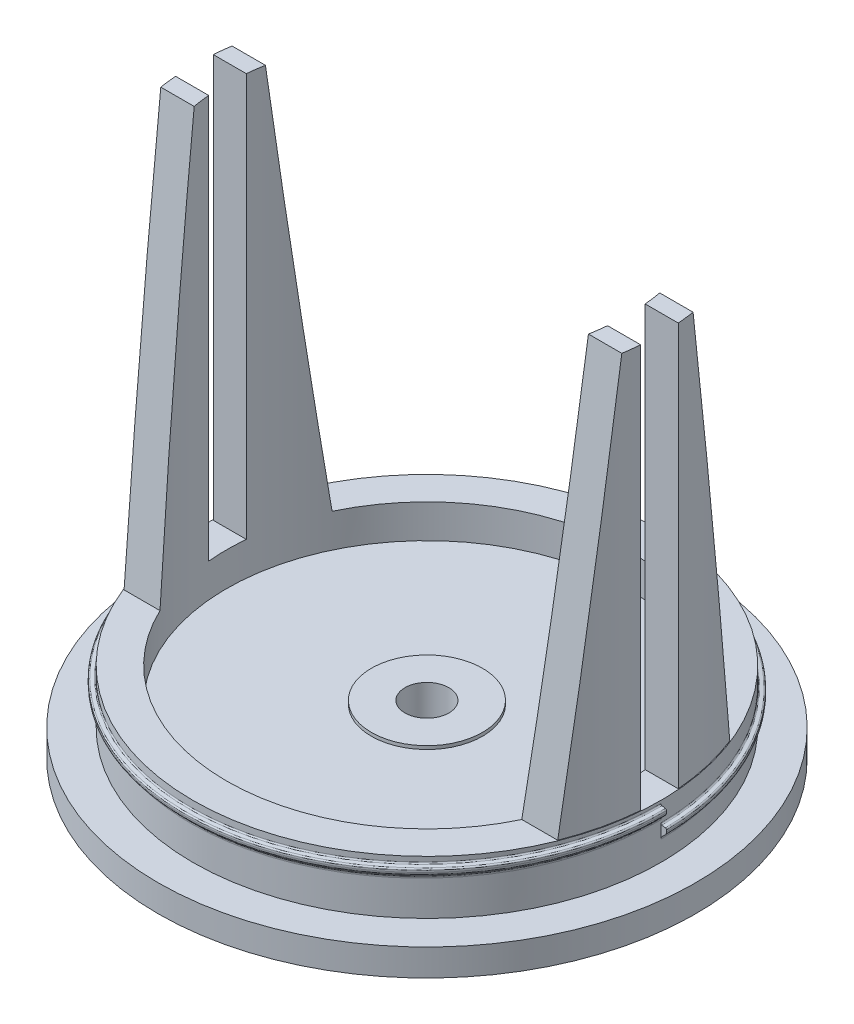
from build123d import *
from build123d.topology import SkipClean

# Parameters (mm, degrees)
SKETCH1_R           = 50.8
BOSS_EXTRUDE1_DEPTH = 5.08
SKETCH2_R           = 44.196
BOSS_EXTRUDE2_DEPTH = 10.16
THREAD1_PITCH       = 3.175
CUT_EXTRUDE1_REACH  = 75.441
SKETCH7_R           = 4.15
SKETCH8_R           = 37.846
SKETCH8_R_2         = 10.5
CUT_EXTRUDE4_DEPTH  = 6.35
SKETCH10_R          = 10.5
CUT_EXTRUDE5_DEPTH  = 5.715
BOSS_EXTRUDE3_DEPTH = 76.2
CUT_EXTRUDE6_REACH  = 118.287
CIRPATTERN2_COUNT   = 2
CUT_EXTRUDE7_DEPTH  = 2.54
FILLET1_R           = 0.762
CIRPATTERN3_COUNT   = 8
SKETCH13_R          = 20.6375
BOSS_EXTRUDE4_DEPTH = 9.525
SKETCH14_R          = 44.196
SKETCH14_R_2        = 44.069
CUT_EXTRUDE9_DEPTH  = 76.2


with BuildPart() as part:
    # Sketch1 → Boss-Extrude1 (new body)
    with BuildSketch(Plane(origin=(0, 0, 0), x_dir=(1, 0, 0), z_dir=(0, 1, 0))):
        with Locations(Location((0, 0, 0), (0, 0, 270))):
            Circle(SKETCH1_R)
    extrude(amount=BOSS_EXTRUDE1_DEPTH)

    # Sketch2 → Boss-Extrude2 (add)
    with BuildSketch(Plane(origin=(0, 5.08, 0), x_dir=(1, 0, 0), z_dir=(0, 1, 0))):
        with Locations(Location((0, 0, 0), (0, 0, 270))):
            Circle(SKETCH2_R)
    extrude(amount=BOSS_EXTRUDE2_DEPTH)

    # Thread1: the profile of Thread Profile1 profile screwed along a right-hand helix of 1 turns, 12 arcs to a turn; built about Z, then put on its axis
    thread1_z = Axis((0, 0, 0), (0, 0, 1))
    thread1_corners = [(44.1957, 0, 0), (44.1957, 0, 2.662362041), (44.196, 0, 2.662362041), (44.405893363, 0, 2.412220872), (45.052906637, 0, 2.298134974), (45.2628, 0, 2.047993805), (45.2628, 0, 1.698061469), (45.039615367, 0, 1.159246102), (44.419184633, 0, 0.538815367), (44.196, 0, 0)]
    with BuildLine(mode=Mode.PRIVATE) as thread1_profile:
        Line(thread1_corners[0], thread1_corners[1])
        Line(thread1_corners[3], thread1_corners[4])
        Line(thread1_corners[5], thread1_corners[6])
        Line(thread1_corners[7], thread1_corners[8])
        Line(thread1_corners[9], thread1_corners[0])
        Line(thread1_corners[2], thread1_corners[1])
        ThreePointArc((44.196, 0, 2.662362041), (44.255424711, 0, 2.499093988), (44.405893363, 0, 2.412220872))
        ThreePointArc((45.052906637, 0, 2.298134974), (45.203375289, 0, 2.211261858), (45.2628, 0, 2.047993805))
        ThreePointArc((45.2628, 0, 1.698061469), (45.204796204, 0, 1.406456694), (45.039615367, 0, 1.159246102))
        ThreePointArc((44.419184633, 0, 0.538815367), (44.254003796, 0, 0.291604775), (44.196, 0, 0))
    thread1_cap = Face(thread1_profile.wire())
    thread1_arcs = [((44.196, 0, 2.662362041), (44.196, 0, 2.449230735), (44.405893363, 0, 2.412220872), (1, 0.7660444431189758, 1)), ((45.052906637, 0, 2.298134974), (45.2628, 0, 2.261125112), (45.2628, 0, 2.047993805), (1, 0.7660444431189757, 1)), ((45.2628, 0, 1.698061469), (45.2628, 0, 1.382430735), (45.039615367, 0, 1.159246102), (1, 0.923879532511285, 1)), ((44.419184633, 0, 0.538815367), (44.196, 0, 0.315630735), (44.196, 0, 0), (1, 0.9238795325112861, 1))]  # start, shoulder, end, weights
    thread1_turn_angles = [0, 15, 30, 45, 60, 75, 90, 105, 120, 135, 150, 165, 180, 195, 210, 225, 240, 255, 270, 285, 300, 315, 330, 345, 360]
    thread1_turn_weights = [1, 0.9659258262890683, 1, 0.9659258262890683, 1, 0.9659258262890683, 1, 0.9659258262890683, 1, 0.9659258262890683, 1, 0.9659258262890683, 1, 0.9659258262890683, 1, 0.9659258262890683, 1, 0.9659258262890683, 1, 0.9659258262890683, 1, 0.9659258262890683, 1, 0.9659258262890683, 1]
    thread1_turn_rails = [Edge.make_bspline([Vector(p[0], p[1], 0).rotate(thread1_z, thread1_turn_angles[k]) / thread1_turn_weights[k] + Vector(0, 0, p[2] + THREAD1_PITCH * thread1_turn_angles[k] / 360) for k in range(25)], [0, 0, 0, 1, 1, 2, 2, 3, 3, 4, 4, 5, 5, 6, 6, 7, 7, 8, 8, 9, 9, 10, 10, 11, 11, 12, 12, 12], 2, thread1_turn_weights) for p in thread1_corners]
    thread1_turn_sides = [*[Face.make_surface_from_curves(thread1_turn_rails[p[0]], thread1_turn_rails[p[1]]) for p in [(0, 1), (3, 4), (5, 6), (7, 8), (9, 0), (2, 1)]], *[Face.make_bezier_surface([[Vector(p[j][0], p[j][1], 0).rotate(thread1_z, thread1_turn_angles[2 * i + k]) / thread1_turn_weights[2 * i + k] + Vector(0, 0, p[j][2] + THREAD1_PITCH * thread1_turn_angles[2 * i + k] / 360) for k in range(3)] for j in range(3)], [[p[3][j] * thread1_turn_weights[2 * i + k] for k in range(3)] for j in range(3)]) for p in thread1_arcs for i in range(12)]]
    thread1 = Plane(origin=(0, 8.89, 0), x_dir=(1, 0, 0), z_dir=(0, 1, 0)) * Solid(Shell([*thread1_turn_sides, thread1_cap, thread1_cap.rotate(thread1_z, 360).moved(Location((0, 0, THREAD1_PITCH * 360 / 360)))]))
    add(thread1)

    # Sketch7 → Cut-Extrude1 (cut, up to next)
    with BuildSketch(Plane.XZ, mode=Mode.PRIVATE) as cut_extrude1_sk1:
        with Locations(Location((0, 0, 0), (0, 0, 270))):
            Circle(SKETCH7_R)
    cut_extrude1_tool1 = extrude(cut_extrude1_sk1.sketch, amount=-CUT_EXTRUDE1_REACH, mode=Mode.PRIVATE) & part.part
    add(cut_extrude1_tool1.solids().sort_by_distance((0, 0, 0))[0], mode=Mode.SUBTRACT)

    # Sketch8 → Cut-Extrude4 (cut)
    with BuildSketch(Plane(origin=(0, 15.24, 0), x_dir=(1, 0, 0), z_dir=(0, 1, 0))):
        with Locations(Location((0, 0, 0), (0, 0, 270))):
            Circle(SKETCH8_R)
        with Locations(Location((0, 0, 0), (0, 0, 270))):
            Circle(SKETCH8_R_2, mode=Mode.SUBTRACT)
    extrude(amount=-CUT_EXTRUDE4_DEPTH, mode=Mode.SUBTRACT)

    # Sketch10 → Cut-Extrude5 (cut)
    with BuildSketch(Plane(origin=(0, 15.24, 0), x_dir=(1, 0, 0), z_dir=(0, 1, 0))):
        with Locations(Location((0, 0, 0), (0, 0, 270))):
            Circle(SKETCH10_R)
    extrude(amount=-CUT_EXTRUDE5_DEPTH, mode=Mode.SUBTRACT)

    # Sketch11 → Boss-Extrude3 (add)
    with SkipClean():  # the faces are left unmerged after this step: merging them gives an invalid solid
        with BuildSketch(Plane(origin=(0, 15.24, 0), x_dir=(1, 0, 0), z_dir=(0, 1, 0))):
            with BuildLine():
                Line((-41.097796535, 16.256), (-34.176924671, 16.256))
                ThreePointArc((-34.176924671, 16.256), (-36.484592657, 10.059533522), (-37.67856924, 3.556))
                Line((-37.67856924, 3.556), (-44.052710246, 3.556))
                ThreePointArc((-44.052710246, 3.556), (-43.046192645, 10.015573611), (-41.097796535, 16.256))
            make_face()
            with BuildLine():
                Line((-41.097796535, -16.256), (-34.176924671, -16.256))
                ThreePointArc((-34.176924671, -16.256), (-36.484592657, -10.059533522), (-37.67856924, -3.556))
                Line((-37.67856924, -3.556), (-44.052710246, -3.556))
                ThreePointArc((-44.052710246, -3.556), (-43.046192645, -10.015573611), (-41.097796535, -16.256))
            make_face()
        boss_extrude3 = extrude(amount=BOSS_EXTRUDE3_DEPTH)

    # Sketch12 → Cut-Extrude6 (cut, up to next)
    with BuildSketch(Plane(origin=(0, 0, 0), x_dir=(0, 0, -1), z_dir=(1, 0, 0)), mode=Mode.PRIVATE) as cut_extrude6_sk1:
        Polygon((16.256, 91.44), (16.256, 15.24), (6.731, 91.44), align=None)
    cut_extrude6_tool1 = extrude(cut_extrude6_sk1.sketch, amount=-CUT_EXTRUDE6_REACH, mode=Mode.PRIVATE) & part.part
    # Sketch12 → Cut-Extrude6 (cut, up to next)
    with BuildSketch(Plane(origin=(0, 0, 0), x_dir=(0, 0, -1), z_dir=(1, 0, 0)), mode=Mode.PRIVATE) as cut_extrude6_sk2:
        Polygon((-16.256, 91.44), (-16.256, 15.24), (-6.731, 91.44), align=None)
    cut_extrude6_tool2 = extrude(cut_extrude6_sk2.sketch, amount=-CUT_EXTRUDE6_REACH, mode=Mode.PRIVATE) & part.part
    cut_extrude6_1 = cut_extrude6_tool1.solids().sort_by_distance((0, 66.04, -13.081))[0]
    add(cut_extrude6_1, mode=Mode.SUBTRACT)
    cut_extrude6_2 = cut_extrude6_tool2.solids().sort_by_distance((0, 66.04, 13.081))[0]
    add(cut_extrude6_2, mode=Mode.SUBTRACT)
    cut_extrude6 = cut_extrude6_1 + cut_extrude6_2  # Cut-Extrude6 as one shape, for the pattern or mirror that repeats it

    # CirPattern2: Boss-Extrude3, Cut-Extrude6 ×2 about axis
    with SkipClean():  # the faces are left unmerged after this step: merging them gives an invalid solid
        cirpattern2_axis = Axis((0, 15.241, 0), (0, -1, 0))
        add([boss_extrude3.rotate(cirpattern2_axis, i * 360 / CIRPATTERN2_COUNT) for i in range(1, CIRPATTERN2_COUNT)])
        add([cut_extrude6.rotate(cirpattern2_axis, i * 360 / CIRPATTERN2_COUNT) for i in range(1, CIRPATTERN2_COUNT)], mode=Mode.SUBTRACT)

    # Sketch9 → Cut-Extrude7 (cut)
    with SkipClean():  # the faces are left unmerged after this step: merging them gives an invalid solid
        with BuildSketch(Plane.XZ):
            with BuildLine():
                Line((-35.759325707, 3.175), (-44.336462139, 3.175))
                ThreePointArc((-44.336462139, 3.175), (-44.45, 0), (-44.336462139, -3.175))
                Line((-44.336462139, -3.175), (-35.759325707, -3.175))
                ThreePointArc((-35.759325707, -3.175), (-35.9, 0), (-35.759325707, 3.175))
            make_face()
            with BuildLine():
                ThreePointArc((44.45, 0), (44.421606466, 1.588514703), (44.336462139, 3.175))
                Line((44.336462139, 3.175), (35.759325707, 3.175))
                ThreePointArc((35.759325707, 3.175), (35.864814184, 1.589057445), (35.9, 0))
                ThreePointArc((35.9, 0), (35.864814184, -1.589057445), (35.759325707, -3.175))
                Line((35.759325707, -3.175), (44.336462139, -3.175))
                ThreePointArc((44.336462139, -3.175), (44.421606466, -1.588514703), (44.45, 0))
            make_face()
        cut_extrude7 = extrude(amount=-CUT_EXTRUDE7_DEPTH, mode=Mode.SUBTRACT)

    # Fillet1
    fillet1_edges = [part.edges().sort_by_distance(p)[0] for p in [
        (-40.047893923, 2.54, -3.175),
        (-44.45, 2.54, 0),
        (-35.9, 2.54, 0),
        (-40.047893923, 2.54, 3.175),
        (44.45, 2.54, 0),
        (40.047893923, 2.54, -3.175),
        (35.9, 2.54, 0),
        (40.047893923, 2.54, 3.175),
    ]]
    fillet(fillet1_edges, radius=FILLET1_R)

    # CirPattern3: Cut-Extrude7 ×8 about axis
    with SkipClean():  # the faces are left unmerged after this step: merging them gives an invalid solid
        cirpattern3_axis = Axis((0, 0, 0), (0, 1, 0))
        for i in range(1, CIRPATTERN3_COUNT):
            add(cut_extrude7.rotate(cirpattern3_axis, i * 360 / CIRPATTERN3_COUNT), mode=Mode.SUBTRACT)

    # Sketch13 → Boss-Extrude4 (add)
    with SkipClean():  # the faces are left unmerged after this step: merging them gives an invalid solid
        with BuildSketch(Plane.XZ):
            Polygon((30.1625, -17.414327494), (30.1625, 17.414327494), (0, 34.828654989), (-30.1625, 17.414327494), (-30.1625, -17.414327494), (0, -34.828654989), align=None)
            with Locations(Location((0, 0, 0), (0, 0, 90))):
                Circle(SKETCH13_R, mode=Mode.SUBTRACT)
        extrude(amount=BOSS_EXTRUDE4_DEPTH)

    # Sketch14 → Cut-Extrude9 (cut)
    with BuildSketch(Plane(origin=(0, 15.24, 0), x_dir=(1, 0, 0), z_dir=(0, 1, 0))):
        with Locations(Location((0, 0, 0), (0, 0, 270))):
            Circle(SKETCH14_R)
        Circle(SKETCH14_R_2, mode=Mode.SUBTRACT)
    extrude(amount=CUT_EXTRUDE9_DEPTH, mode=Mode.SUBTRACT)


solid = part.part
